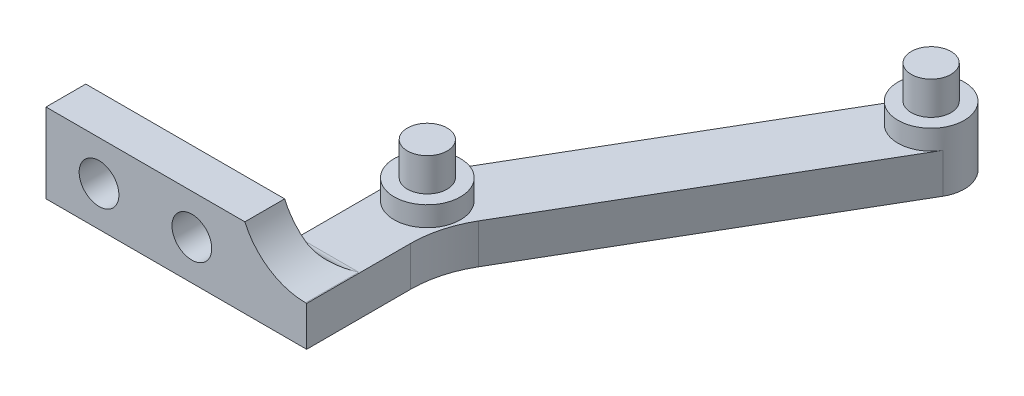
from build123d import *

# Parameters (mm, degrees)
BOSS_EXTRUDE1_DEPTH = 3
SKETCH1_4_R         = 2.5000000000000004
SKETCH1_4_R_2       = 1.5
SKETCH1_4_R_3       = 2.500000000000002
SKETCH1_4_R_4       = 1.5000000000000009
BOSS_EXTRUDE2_DEPTH = 4.5
SKETCH1_5_R         = 1.5
SKETCH1_5_R_2       = 1.5000000000000009
BOSS_EXTRUDE3_DEPTH = 7
BOSS_EXTRUDE4_DEPTH = 15
SKETCH4_R           = 1.4999999999999987
SKETCH4_R_2         = 1.5000000000000007
CUT_EXTRUDE1_DEPTH  = 20
FILLET1_R           = 5
FILLET2_R           = 1
FILLET3_R           = 8


with BuildPart() as part:
    # Sketch1 → Boss-Extrude1 (new body)
    with BuildSketch(Plane(origin=(0, 0, 0), x_dir=(1, 0, 0), z_dir=(0, 1, 0))):
        with BuildLine():
            Line((11.840552747753916, 25.259677563810218), (-2.159447252246084, 1.2596775638102156))
            ThreePointArc((-2.1594472522460837, 1.2596775638102162), (0.6524499480361662, 2.413360533635123), (2.5000000000000004, 0))
            ThreePointArc((2.5000000000000004, -6.1e-16), (2.413360533635123, -0.6524499480361662), (2.159447252246083, -1.2596775638102173))
            Line((2.159447252246083, -1.2596775638102156), (16.15944725224609, 22.740322436189782))
            ThreePointArc((16.159447252246085, 22.740322436189782), (12.740322436189784, 21.840552747753915), (11.840552747753918, 25.259677563810218))
        make_face()
        Polygon((2.1594472522460837, -3), (-2.5, -3), (-2.499999999999999, -11.259677563810214), (2.1594472522460846, -11.259677563810214), align=None)
        with BuildLine():
            ThreePointArc((2.159447252246083, -1.2596775638102173), (-0.6524499480361661, -2.413360533635123), (-2.5000000000000004, 3.1e-16))
            Line((-2.5000000000000004, 0), (-2.5, -3))
            Line((-2.5, -3), (2.1594472522460837, -3))
            Line((2.1594472522460832, -3), (2.159447252246083, -1.2596775638102156))
        make_face()
    extrude(amount=BOSS_EXTRUDE1_DEPTH)

    # Sketch1<4> → Boss-Extrude2 (add)
    # profile 1 of 2: a face of its own
    with BuildSketch(Plane(origin=(0, 0, 0), x_dir=(1, 0, 0), z_dir=(0, 1, 0))):
        with Locations(Location((0, 0, 0), (0, 0, 149.743562836))):
            Circle(SKETCH1_4_R)
        with Locations(Location((0, 0, 0), (0, 0, 270))):
            Circle(SKETCH1_4_R_2, mode=Mode.SUBTRACT)
    # profile 2 of 2: a face of its own
    with BuildSketch(Plane(origin=(0, 0, 0), x_dir=(1, 0, 0), z_dir=(0, 1, 0))):
        with Locations(Location((14.000000000000002, 24, 0), (0, 0, 149.743562836))):
            Circle(SKETCH1_4_R_3)
        with Locations(Location((14.000000000000002, 24, 0), (0, 0, 270))):
            Circle(SKETCH1_4_R_4, mode=Mode.SUBTRACT)
    extrude(amount=BOSS_EXTRUDE2_DEPTH)

    # Sketch1<5> → Boss-Extrude3 (add)
    with BuildSketch(Plane(origin=(0, 0, 0), x_dir=(1, 0, 0), z_dir=(0, 1, 0))):
        with Locations(Location((0, 0, 0), (0, 0, 270))):
            Circle(SKETCH1_5_R)
        with Locations(Location((14.000000000000002, 24, 0), (0, 0, 270))):
            Circle(SKETCH1_5_R_2)
    extrude(amount=BOSS_EXTRUDE3_DEPTH)

    # Sketch3 → Boss-Extrude4 (add)
    with BuildSketch(Plane.ZY.offset(2.5000000000000004)):
        Polygon((11.259677563810214, 0), (8.259677563810214, -3.7e-16), (8.259677563810214, 6), (11.259677563810214, 6.000000000000001), align=None)
    extrude(amount=BOSS_EXTRUDE4_DEPTH)

    # Sketch4 → Cut-Extrude1 (cut)
    with BuildSketch(Plane(origin=(9.5e-16, 0, 8.259677563810214), x_dir=(-1, 0, 1.2e-16), z_dir=(-1.2e-16, 0, -1))):
        with Locations((6.500000000000001, 2.999999999999998)):
            Circle(SKETCH4_R)
        with Locations((13.499999999999998, 2.9999999999999996)):
            Circle(SKETCH4_R_2)
    extrude(amount=-CUT_EXTRUDE1_DEPTH, mode=Mode.SUBTRACT)

    # Fillet1
    # the kernel refuses this fillet: 5 mm, written as the material it adds along each edge
    with BuildSketch(Plane(origin=(-2.499999999999999, 3, 11.259677563810214), x_dir=(1, 0, -1.6e-16), z_dir=(-1.6e-16, 0, -1))) as fillet1_piece_1:
        with BuildLine():
            CenterArc((4.582575694955841, -5), FILLET1_R, 90, 66.42182152179817)
            Line((8.9e-16, -3), (0, 0))
            Line((0, 0), (4.582575694955841, 0))
        make_face()
    extrude(amount=3)

    # Fillet2
    fillet2_edges = [part.edges().sort_by_distance(p)[0] for p in [
        (-2.4999999999999996, 1.4999999999999998, 8.259677563810214),
        (-0.20871215252200015, 3, 8.25967756381),
    ]]
    fillet(fillet2_edges, radius=FILLET2_R)

    # Fillet3
    fillet3_edges = [part.edges().sort_by_distance(p)[0] for p in [
        (2.159447252246083, 1.5, 1.2596775638102164),
    ]]
    fillet(fillet3_edges, radius=FILLET3_R)


solid = part.part
